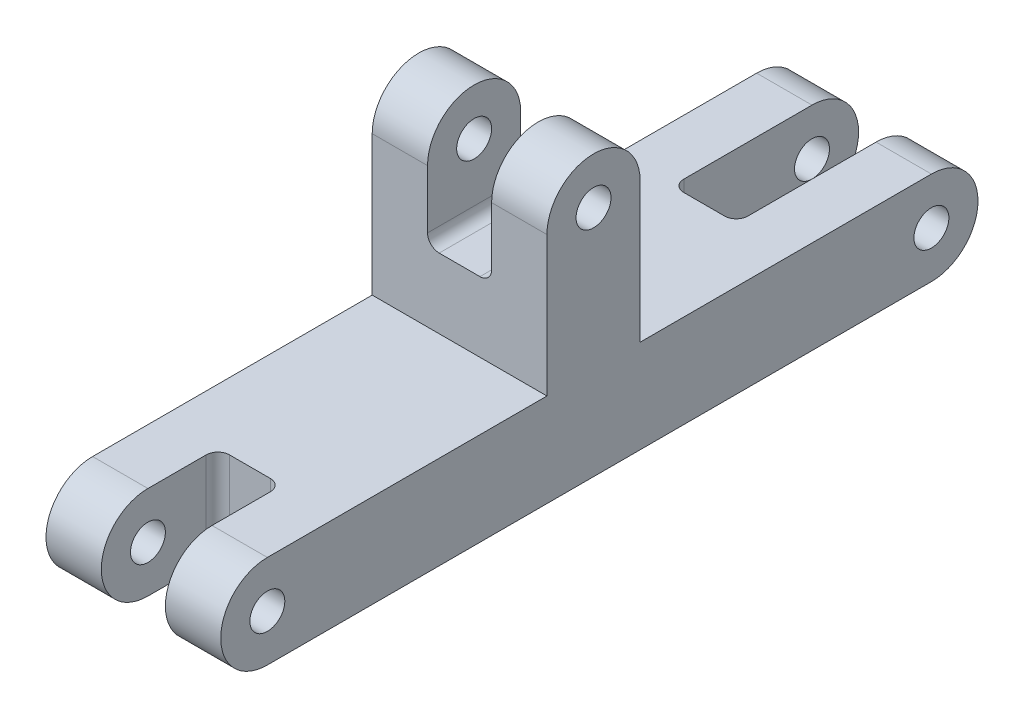
from build123d import *

# Parameters (mm, degrees)
CROQUIS1_R              = 1.5
SALIENTE_EXTRUIR1_DEPTH = 7.5
CROQUIS2_W              = 8
CROQUIS2_H              = 10
CROQUIS2_W_2            = 16
CROQUIS2_H_2            = 8
CROQUIS2_W_3            = 10
CORTAR_EXTRUIR1_DEPTH   = 2.75
REDONDEO1_R             = 1


with BuildPart() as part:
    # Croquis1 → Saliente-Extruir1 (new, symmetric)
    with BuildSketch(Plane(origin=(0, 0, 0), x_dir=(0, 0, -1), z_dir=(1, 0, 0))):
        with BuildLine():
            Line((-12.5, -4), (12.5, -4))
            ThreePointArc((12.5, -4), (16.5, 0), (12.5, 4))
            Line((12.5, 4), (-12.5, 4))
            Line((-12.5, 4), (-12.5, 16))
            ThreePointArc((-12.5, 16), (-16.5, 20), (-20.5, 16))
            Line((-20.5, 16), (-20.5, 4))
            Line((-20.5, 4), (-44.5, 4))
            ThreePointArc((-44.5, 4), (-48.5, 0), (-44.5, -4))
            Line((-44.5, -4), (-12.5, -4))
        make_face()
        with Locations((12.5, 0)):
            Circle(CROQUIS1_R, mode=Mode.SUBTRACT)
        with Locations((-16.5, 16)):
            Circle(CROQUIS1_R, mode=Mode.SUBTRACT)
        with Locations((-44.5, 0)):
            Circle(CROQUIS1_R, mode=Mode.SUBTRACT)
    extrude(amount=SALIENTE_EXTRUIR1_DEPTH, both=True)

    # Croquis2 → Cortar-Extruir1 (cut, symmetric)
    with BuildSketch(Plane(origin=(0, 0, 0), x_dir=(0, 0, -1), z_dir=(1, 0, 0))):
        with Locations((-16.5, 15)):
            Rectangle(CROQUIS2_W, CROQUIS2_H)
        with Locations((8.5, 0)):
            Rectangle(CROQUIS2_W_2, CROQUIS2_H_2)
        with Locations((-43.5, 0)):
            Rectangle(CROQUIS2_W_3, CROQUIS2_H_2)
    extrude(amount=CORTAR_EXTRUIR1_DEPTH, both=True, mode=Mode.SUBTRACT)

    # Redondeo1
    redondeo1_edges = [part.edges().sort_by_distance(p)[0] for p in [
        (2.75, 0, 38.5),
        (-2.75, 0, 38.5),
        (2.75, 0, -0.5),
        (-2.75, 0, -0.5),
        (2.75, 10, 16.5),
        (-2.75, 10, 16.5),
    ]]
    fillet(redondeo1_edges, radius=REDONDEO1_R)


solid = part.part
